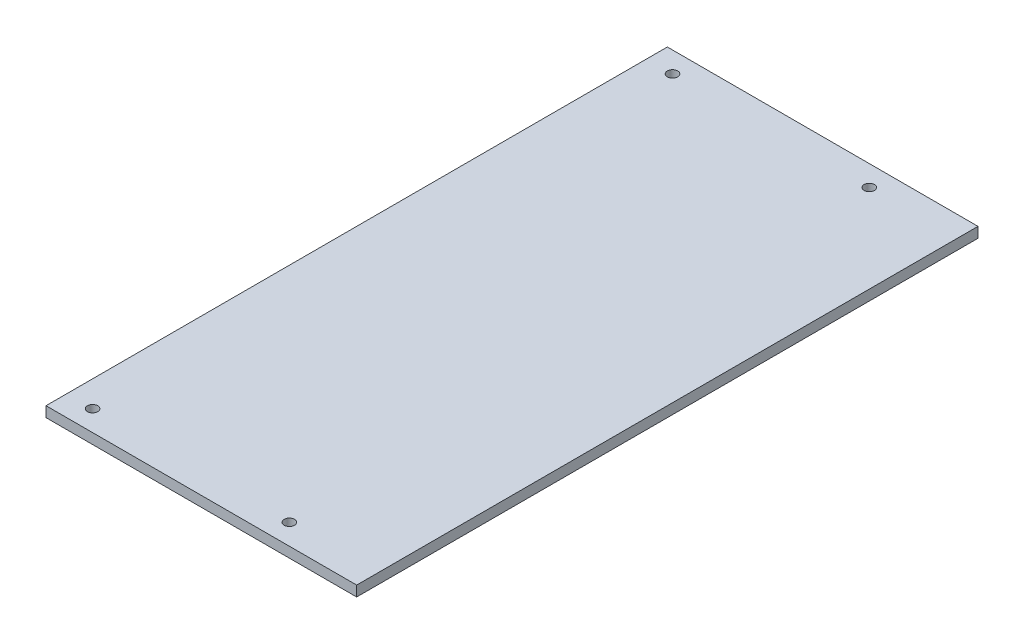
from build123d import *

# Parameters (mm, degrees)
SKETCH1_W           = 90
SKETCH1_H           = 180
SKETCH1_R           = 1.5
BOSS_EXTRUDE1_DEPTH = 3


with BuildPart() as part:
    # Sketch1 → Boss-Extrude1 (new body)
    with BuildSketch(Plane(origin=(0, 0, 0), x_dir=(1, 0, 0), z_dir=(0, 1, 0))):
        Rectangle(SKETCH1_W, SKETCH1_H)
        with Locations((19.5, -84)):
            Circle(SKETCH1_R, mode=Mode.SUBTRACT)
        with Locations((-37.5, -84)):
            Circle(SKETCH1_R, mode=Mode.SUBTRACT)
        with Locations((19.5, 84)):
            Circle(SKETCH1_R, mode=Mode.SUBTRACT)
        with Locations((-37.5, 84)):
            Circle(SKETCH1_R, mode=Mode.SUBTRACT)
    extrude(amount=BOSS_EXTRUDE1_DEPTH)


solid = part.part
